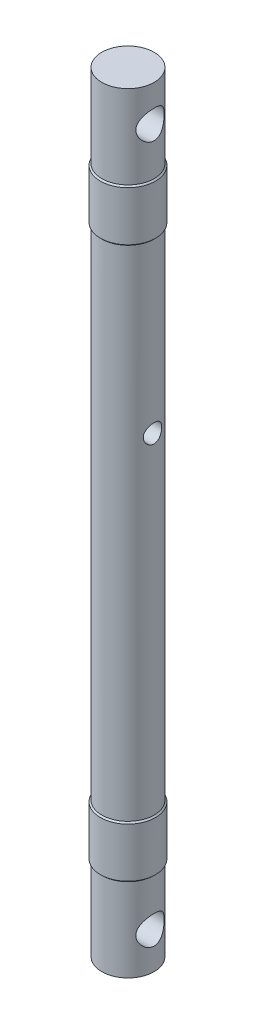
from build123d import *

# Parameters (mm, degrees)
SKETCH1_R                      = 3.7
BOSS_EXTRUDE1_DEPTH            = 109
F_4_0MM_DOWEL_HOLE1_AT_2_COUNT = 2
F_4_0MM_DOWEL_HOLE1_AT_2_PITCH = 98.7
F_4_0MM_DOWEL_HOLE2_AT_2_COUNT = 2
F_4_0MM_DOWEL_HOLE2_AT_2_PITCH = 98.7
SKETCH7_W                      = 0.2
SKETCH7_H                      = 7
CHAMFER1_SIZE                  = 0.2
CUT_EXTRUDE2_DEPTH             = 110.139452178
CUT_EXTRUDE2_DEPTH_BACK        = 110.139452178
SKETCH8_R                      = 1.3


with BuildPart() as part:
    # Sketch1 → Boss-Extrude1 (new body)
    with BuildSketch(Plane(origin=(0, 0, 0), x_dir=(1, 0, 0), z_dir=(0, 1, 0))):
        with Locations(Location((0, 0, 0), (0, 0, 270))):
            Circle(SKETCH1_R)
    extrude(amount=BOSS_EXTRUDE1_DEPTH)

    # Sketch4 → Ø4.0mm Dowel Hole1 (revolve, cut)
    with BuildSketch(Plane(origin=(0, 5.15, 0), x_dir=(0, 0, -1), z_dir=(0, 1, 0))):
        Polygon((0, 0), (0, 3.7), (2, 3.7), (2, 0.025), (2.025, 0), align=None)
    f_4_0mm_dowel_hole1 = revolve(axis=Axis((6.35, 5.15, 0), (-1, 0, 0)), mode=Mode.SUBTRACT)

    # Ø4.0mm Dowel Hole1 at 2: Ø4.0mm Dowel Hole1 ×2
    with Locations(*[(0, i * F_4_0MM_DOWEL_HOLE1_AT_2_PITCH, 0) for i in range(1, F_4_0MM_DOWEL_HOLE1_AT_2_COUNT)]):
        add(f_4_0mm_dowel_hole1, mode=Mode.SUBTRACT)

    # Sketch6 → Ø4.0mm Dowel Hole2 (revolve, cut)
    with BuildSketch(Plane.ZX.offset(103.85)):
        Polygon((0, 0), (0, 3.7), (2, 3.7), (2, 0.025), (2.025, 0), align=None)
    f_4_0mm_dowel_hole2 = revolve(axis=Axis((-6.35, 103.85, 0), (1, 0, 0)), mode=Mode.SUBTRACT)

    # Ø4.0mm Dowel Hole2 at 2: Ø4.0mm Dowel Hole2 ×2
    with Locations(*[(0, -i * F_4_0MM_DOWEL_HOLE2_AT_2_PITCH, 0) for i in range(1, F_4_0MM_DOWEL_HOLE2_AT_2_COUNT)]):
        add(f_4_0mm_dowel_hole2, mode=Mode.SUBTRACT)

    # Sketch7 → Revolve1 (revolve)
    with BuildSketch(Plane(origin=(0, 0, 0), x_dir=(0, 0, -1), z_dir=(1, 0, 0)), mode=Mode.PRIVATE) as revolve1_sk:
        with Locations((3.8, 93.5)):
            Rectangle(SKETCH7_W, SKETCH7_H)
        with Locations((3.8, 15.5)):
            Rectangle(SKETCH7_W, SKETCH7_H)
    revolve(revolve1_sk.sketch.rotate(Axis((0, 99.222233113, 0), (0, -1, 0)), 180), axis=Axis((0, 99.222233113, 0), (0, -1, 0)))

    # Chamfer1
    chamfer1_edges = [part.edges().sort_by_distance(p)[0] for p in [
        (0, 97, -3.7),
        (0, 90, -3.7),
        (0, 19, -3.7),
        (0, 12, -3.7),
    ]]
    chamfer(chamfer1_edges, length=CHAMFER1_SIZE - 0.0001)  # a hair under: the kernel refuses the full size

    # Sketch8 → Cut-Extrude2 (cut, two sides: drawn at the far end of the back side and taken through both)
    with BuildSketch(Plane(origin=(0, 0, 0), x_dir=(0, 0, -1), z_dir=(1, 0, 0)).offset(-CUT_EXTRUDE2_DEPTH_BACK)):
        with Locations((0, 66)):
            Circle(SKETCH8_R)
    extrude(amount=CUT_EXTRUDE2_DEPTH + CUT_EXTRUDE2_DEPTH_BACK, mode=Mode.SUBTRACT)


solid = part.part
